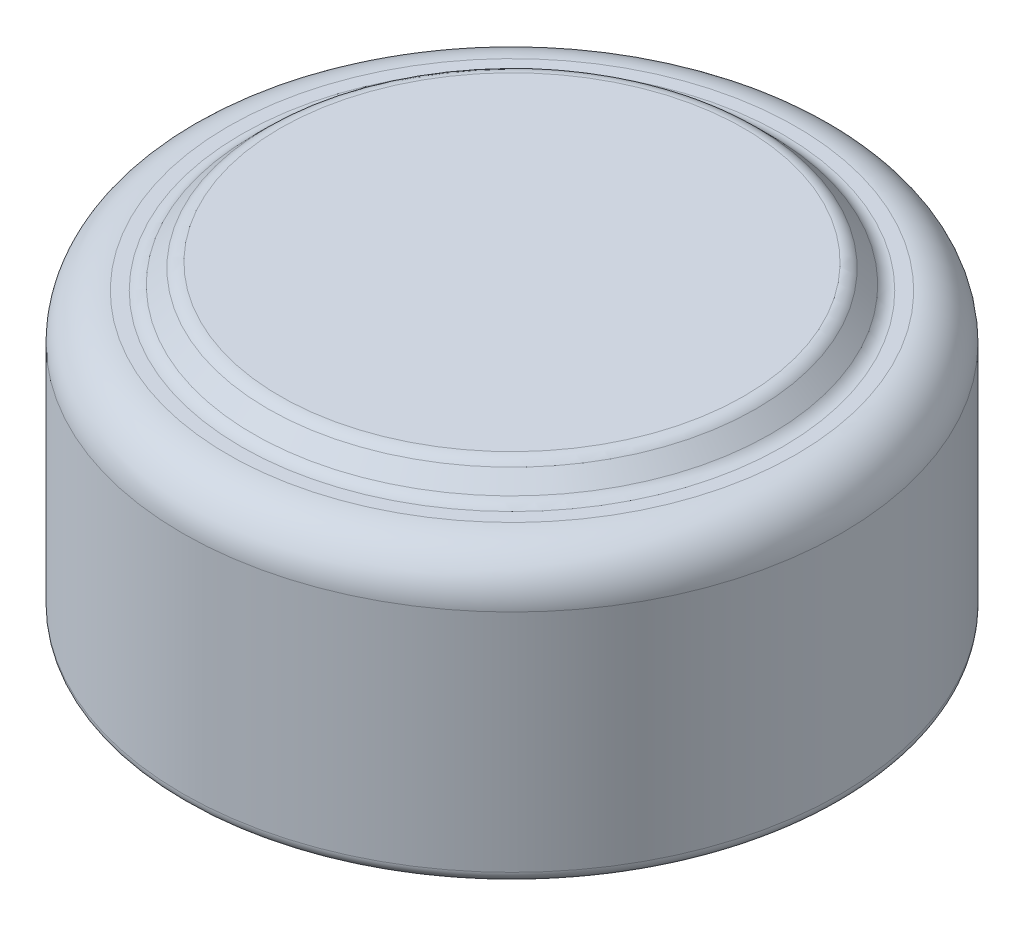
from build123d import *


with BuildPart() as part:
    # Sketch1 → Revolve1 (revolve)
    with BuildSketch(Plane.XY):
        with BuildLine():
            Line((0, 0), (-2.8, 0))
            ThreePointArc((-2.8, 0), (-2.870710678, 0.029289322), (-2.9, 0.1))
            Line((-2.9, 0.1), (-2.9, 2.084))
            ThreePointArc((-2.9, 2.084), (-2.782842712, 2.366842712), (-2.5, 2.484))
            Line((-2.5, 2.484), (-2.382132034, 2.484))
            ThreePointArc((-2.382132034, 2.484), (-2.32472952, 2.49541807), (-2.276066017, 2.527933983))
            Line((-2.276066017, 2.527933983), (-2.147933983, 2.656066017))
            ThreePointArc((-2.147933983, 2.656066017), (-2.09927048, 2.68858193), (-2.041867966, 2.7))
            Line((-2.041867966, 2.7), (0, 2.7))
            Line((0, 2.7), (0, 0))
        make_face()
    revolve(axis=Axis((0, 2.7, 0), (0, -1, 0)))


solid = part.part
